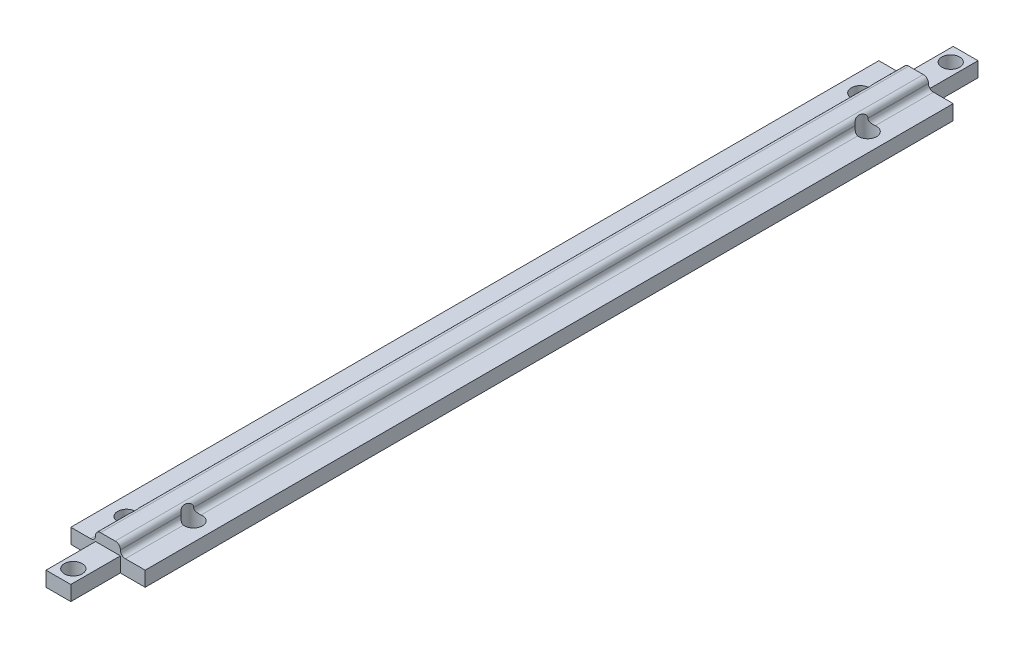
from build123d import *

# Parameters (mm, degrees)
SKETCH1_W               = 5
SKETCH1_H               = 163
BOSS_EXTRUDE1_DEPTH     = 3
BOSS_EXTRUDE2_DEPTH     = 81.5
BOSS_EXTRUDE3_START     = 81.5
BOSS_EXTRUDE3_DEPTH     = 81.5
SKETCH8_W               = 5
SKETCH8_H               = 10
BOSS_EXTRUDE4_DEPTH     = 3
SKETCH6_R               = 1.8
CUT_EXTRUDE1_DEPTH      = 92.58329542
SKETCH9_W               = 15
SKETCH9_H               = 163
BOSS_EXTRUDE5_DEPTH     = 3
FILLET1_R               = 1
CUT_EXTRUDE2_DEPTH      = 92.855865354
CUT_EXTRUDE2_DEPTH_BACK = 92.855865354
SKETCH10_R              = 1.8


with BuildPart() as part:
    # Sketch1 → Boss-Extrude1 (new body)
    with BuildSketch(Plane(origin=(0, 0, 0), x_dir=(1, 0, 0), z_dir=(0, 1, 0))):
        Rectangle(SKETCH1_W, SKETCH1_H)
    extrude(amount=BOSS_EXTRUDE1_DEPTH)

    # Sketch3 → Boss-Extrude2 (add)
    with BuildSketch(Plane.XY):
        with BuildLine():
            Line((-2.5, 3), (-2.5, 5.102989898))
            ThreePointArc((-2.5, 5.102989898), (0, 5.05), (2.5, 5.102989898))
            Line((2.5, 5.102989898), (2.5, 3))
            Line((2.5, 3), (2.5, 0))
            Line((2.5, 0), (-2.5, 0))
            Line((-2.5, 0), (-2.5, 3))
        make_face()
    extrude(amount=BOSS_EXTRUDE2_DEPTH)

    # Sketch7 → Boss-Extrude3 (add)
    with BuildSketch(Plane(origin=(0, 0, 0), x_dir=(-1, 0, 0), z_dir=(0, 0, -1)).offset(BOSS_EXTRUDE3_START)):
        with BuildLine():
            Line((-2.5, 5.102989898), (-2.5, 3))
            Line((-2.5, 3), (2.5, 3))
            Line((2.5, 3), (2.5, 5.102989898))
            ThreePointArc((2.5, 5.102989898), (0, 5.05), (-2.5, 5.102989898))
        make_face()
    extrude(amount=-BOSS_EXTRUDE3_DEPTH)

    # Sketch8 → Boss-Extrude4 (add)
    with BuildSketch(Plane.XZ):
        with Locations((0, 86.5)):
            Rectangle(SKETCH8_W, SKETCH8_H)
        with Locations((0, -86.5)):
            Rectangle(SKETCH8_W, SKETCH8_H)
    extrude(amount=-BOSS_EXTRUDE4_DEPTH)

    # Sketch6 → Cut-Extrude1 (cut, through all)
    with BuildSketch(Plane(origin=(0, 3, 0), x_dir=(1, 0, 0), z_dir=(0, 1, 0))):
        with Locations(Location((0, -88.5, 0), (0, 0, 270))):
            Circle(SKETCH6_R)
        with Locations(Location((0, 88.5, 0), (0, 0, 90))):
            Circle(SKETCH6_R)
    extrude(amount=-CUT_EXTRUDE1_DEPTH, mode=Mode.SUBTRACT)

    # Sketch9 → Boss-Extrude5 (add)
    with BuildSketch(Plane.XZ):
        Rectangle(SKETCH9_W, SKETCH9_H)
    extrude(amount=-BOSS_EXTRUDE5_DEPTH)

    # Fillet1
    # the kernel refuses this fillet: 1 mm, written as the material it adds along each edge
    with BuildSketch(Plane(origin=(2.5, 3, -81.5), x_dir=(0, 1, 0), z_dir=(0, 0, 1)), Plane(origin=(-2.5, 3, 81.5), x_dir=(0, 1, 0), z_dir=(0, 0, -1))) as fillet1_piece_1:
        with BuildLine():
            CenterArc((FILLET1_R, -FILLET1_R), FILLET1_R, 90, 90)
            Line((0, -FILLET1_R), (0, 0))
            Line((0, 0), (FILLET1_R, 0))
        make_face()
    extrude(amount=163)
    # the kernel refuses this fillet: 1 mm, written as the material it takes off along each edge
    with BuildSketch(Plane(origin=(-2.5, 5.102989898, 84.085592418), x_dir=(0, -1, 0), z_dir=(0, 0, -1))) as fillet1_2_piece_1:
        with BuildLine():
            CenterArc((1.034236967, -1), FILLET1_R, 90, 91.432543738)
            ThreePointArc((0.034549516, -1.025), (0.019501965, -0.512424928), (0, 0))
            Line((0, 0), (1.034236967, 0))
        make_face()
    extrude(amount=168.171184836, mode=Mode.SUBTRACT)
    with BuildSketch(Plane(origin=(2.5, 5.102989898, 84.085592418), x_dir=(0, -1, 0), z_dir=(0, 0, -1))) as fillet1_2_piece_2:
        with BuildLine():
            CenterArc((1.034236967, 1), FILLET1_R, 178.567456262, 91.432543738)
            ThreePointArc((0.034549516, 1.025), (0.019501965, 0.512424928), (0, 0))
            Line((0, 0), (1.034236967, 0))
        make_face()
    extrude(amount=168.171184836, mode=Mode.SUBTRACT)

    # Sketch10 → Cut-Extrude2 (cut, two sides: drawn at the far end of the back side and taken through both)
    with BuildSketch(Plane(origin=(0, 3, 0), x_dir=(1, 0, 0), z_dir=(0, 1, 0)).offset(-CUT_EXTRUDE2_DEPTH_BACK)):
        with Locations(Location((-3.75, -74, 0), (0, 0, 270))):
            Circle(SKETCH10_R)
        with Locations(Location((3.75, -68, 0), (0, 0, 270))):
            Circle(SKETCH10_R)
        with Locations(Location((3.75, 68, 0), (0, 0, 262.016443854))):
            Circle(SKETCH10_R)
        with Locations(Location((-3.75, 74, 0), (0, 0, 277.983556156))):
            Circle(SKETCH10_R)
    extrude(amount=CUT_EXTRUDE2_DEPTH + CUT_EXTRUDE2_DEPTH_BACK, mode=Mode.SUBTRACT)


solid = part.part
